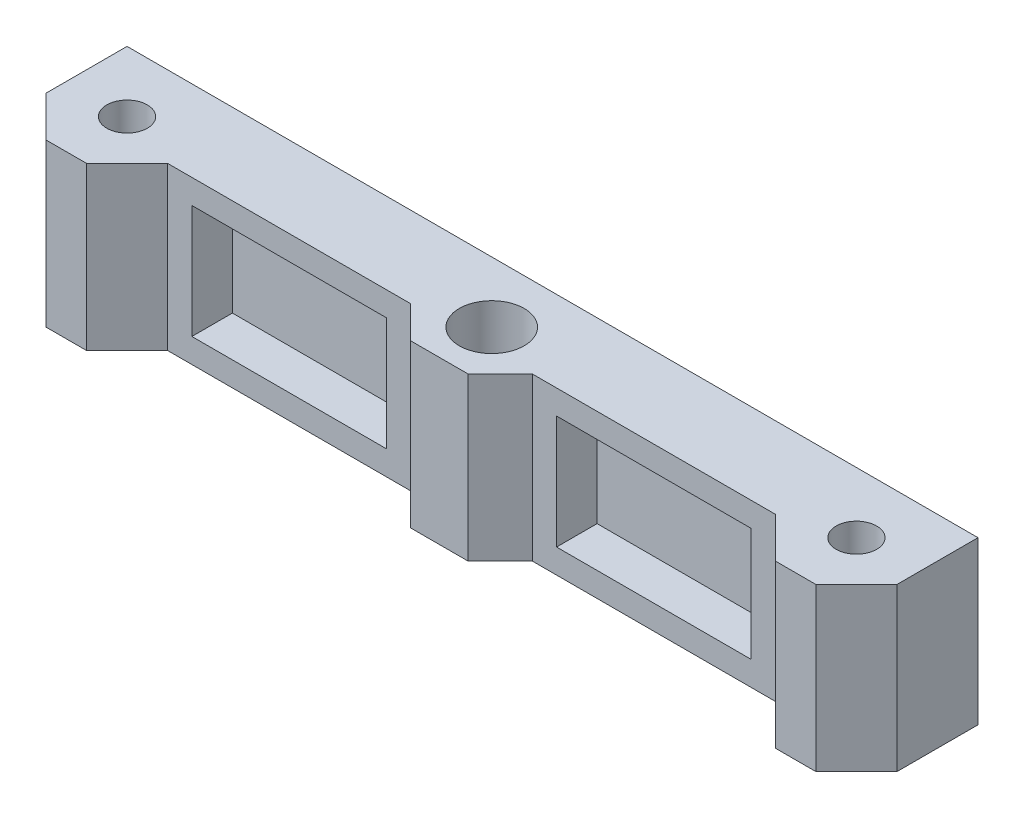
from build123d import *

# Parameters (mm, degrees)
SKETCH2_R           = 4
SKETCH2_R_2         = 2.5
BOSS_EXTRUDE1_DEPTH = 20
SKETCH3_W           = 24
SKETCH3_H           = 14
CUT_EXTRUDE3_DEPTH  = 5


with BuildPart() as part:
    # Sketch2 → Boss-Extrude1 (new body)
    with BuildSketch(Plane(origin=(0, 0, 0), x_dir=(1, 0, 0), z_dir=(0, 1, 0))):
        Polygon((-52.5, -2.5), (-52.5, 7.5), (52.5, 7.5), (52.5, -2.5), (47.5, -7.5), (42.5, -7.5), (37.5, -2.5), (7.5, -2.5), (3.535533906, -6.464466094), (-3.535533906, -6.464466094), (-7.5, -2.5), (-37.5, -2.5), (-42.5, -7.5), (-47.5, -7.5), align=None)
        Circle(SKETCH2_R, mode=Mode.SUBTRACT)
        with Locations((-45, 0)):
            Circle(SKETCH2_R_2, mode=Mode.SUBTRACT)
        with Locations((45, 0)):
            Circle(SKETCH2_R_2, mode=Mode.SUBTRACT)
    extrude(amount=BOSS_EXTRUDE1_DEPTH)

    # Sketch3 → Cut-Extrude3 (cut)
    with BuildSketch(Plane.XY.offset(2.5)):
        with Locations((-22.5, 10)):
            Rectangle(SKETCH3_W, SKETCH3_H)
        with Locations((22.5, 10)):
            Rectangle(SKETCH3_W, SKETCH3_H)
    extrude(amount=-CUT_EXTRUDE3_DEPTH, mode=Mode.SUBTRACT)


solid = part.part
